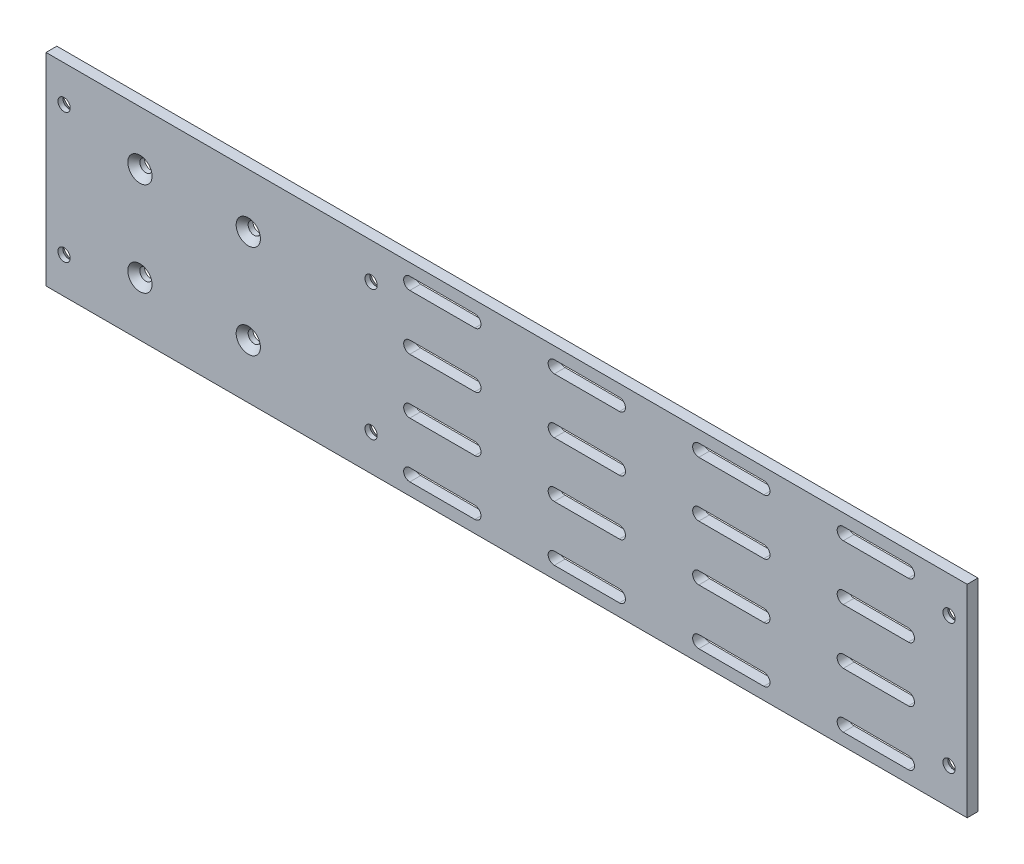
from build123d import *

# Parameters (mm, degrees)
SKETCH_1_W                 = 255
SKETCH_1_H                 = 56
EXTRUDE_1_DEPTH            = 3
HOLE_WIZARD_M32_AT_2_COUNT = 2
HOLE_WIZARD_M32_AT_2_PITCH = 26
HOLE_WIZARD_M32_AT_3_COUNT = 2
HOLE_WIZARD_M32_AT_3_PITCH = 39.698866483
HOLE_WIZARD_M32_AT_4_COUNT = 2
HOLE_WIZARD_M32_AT_4_PITCH = 30
HOLE_WIZARD_M31_AT_2_COUNT = 2
HOLE_WIZARD_M31_AT_2_PITCH = 36
HOLE_WIZARD_M31_AT_3_COUNT = 2
HOLE_WIZARD_M31_AT_3_PITCH = 245
HOLE_WIZARD_M31_AT_4_COUNT = 2
HOLE_WIZARD_M31_AT_4_PITCH = 247.630773532
HOLE_WIZARD_M31_AT_5_COUNT = 2
HOLE_WIZARD_M31_AT_5_PITCH = 85
HOLE_WIZARD_M31_AT_6_COUNT = 2
HOLE_WIZARD_M31_AT_6_PITCH = 92.309262807
CUT_EXTRUDE_3_DEPTH        = 131.572776642


with BuildPart() as part:
    # Эскиз1 → Бобышка-Вытянуть1 (new body)
    with BuildSketch(Plane.XY):
        Rectangle(SKETCH_1_W, SKETCH_1_H)
    extrude(amount=EXTRUDE_1_DEPTH)

    # Эскиз8 → Зенковка для  винта с потайной головкой с внутренним шестигранником M32 (revolve, cut)
    with BuildSketch(Plane(origin=(-101.5, 13, 3), x_dir=(0, -1, 0), z_dir=(1, 0, 0))):
        Polygon((0, 0), (0, 3), (1.7, 3), (1.7, 1.66), (3.36, 0), align=None)
    hole_wizard_m32 = revolve(axis=Axis((-101.5, 13, 9.35), (0, 0, -1)), mode=Mode.SUBTRACT)

    # Зенковка для  винта с потайной головкой с внутренним шестигранником M32 at 2: Зенковка для  винта с потайной головкой с внутренним шестигранником M32 ×2
    with Locations(*[(0, -i * HOLE_WIZARD_M32_AT_2_PITCH, 0) for i in range(1, HOLE_WIZARD_M32_AT_2_COUNT)]):
        add(hole_wizard_m32, mode=Mode.SUBTRACT)

    # Зенковка для  винта с потайной головкой с внутренним шестигранником M32 at 3: Зенковка для  винта с потайной головкой с внутренним шестигранником M32 ×2
    with Locations(*[Vector(0.7556890827898175, -0.6549305384178421, 0) * (i * HOLE_WIZARD_M32_AT_3_PITCH) for i in range(1, HOLE_WIZARD_M32_AT_3_COUNT)]):
        add(hole_wizard_m32, mode=Mode.SUBTRACT)

    # Зенковка для  винта с потайной головкой с внутренним шестигранником M32 at 4: Зенковка для  винта с потайной головкой с внутренним шестигранником M32 ×2
    with Locations(*[(i * HOLE_WIZARD_M32_AT_4_PITCH, 0, 0) for i in range(1, HOLE_WIZARD_M32_AT_4_COUNT)]):
        add(hole_wizard_m32, mode=Mode.SUBTRACT)

    # Эскиз5 → Зенковка для  винта с потайной головкой с внутренним шестигранником M31 (revolve, cut)
    with BuildSketch(Plane(origin=(-122.5, 18, 0), x_dir=(0, 1, 0), z_dir=(1, 0, 0))):
        Polygon((0, 0), (0, 3), (1.7, 3), (1.7, 1.66), (3.36, 0), align=None)
    hole_wizard_m31 = revolve(axis=Axis((-122.5, 18, -6.35), (0, 0, 1)), mode=Mode.SUBTRACT)

    # Зенковка для  винта с потайной головкой с внутренним шестигранником M31 at 2: Зенковка для  винта с потайной головкой с внутренним шестигранником M31 ×2
    with Locations(*[(0, -i * HOLE_WIZARD_M31_AT_2_PITCH, 0) for i in range(1, HOLE_WIZARD_M31_AT_2_COUNT)]):
        add(hole_wizard_m31, mode=Mode.SUBTRACT)

    # Зенковка для  винта с потайной головкой с внутренним шестигранником M31 at 3: Зенковка для  винта с потайной головкой с внутренним шестигранником M31 ×2
    with Locations(*[(i * HOLE_WIZARD_M31_AT_3_PITCH, 0, 0) for i in range(1, HOLE_WIZARD_M31_AT_3_COUNT)]):
        add(hole_wizard_m31, mode=Mode.SUBTRACT)

    # Зенковка для  винта с потайной головкой с внутренним шестигранником M31 at 4: Зенковка для  винта с потайной головкой с внутренним шестигранником M31 ×2
    with Locations(*[Vector(0.989376225360186, -0.1453777310733335, 0) * (i * HOLE_WIZARD_M31_AT_4_PITCH) for i in range(1, HOLE_WIZARD_M31_AT_4_COUNT)]):
        add(hole_wizard_m31, mode=Mode.SUBTRACT)

    # Зенковка для  винта с потайной головкой с внутренним шестигранником M31 at 5: Зенковка для  винта с потайной головкой с внутренним шестигранником M31 ×2
    with Locations(*[(i * HOLE_WIZARD_M31_AT_5_PITCH, 0, 0) for i in range(1, HOLE_WIZARD_M31_AT_5_COUNT)]):
        add(hole_wizard_m31, mode=Mode.SUBTRACT)

    # Зенковка для  винта с потайной головкой с внутренним шестигранником M31 at 6: Зенковка для  винта с потайной головкой с внутренним шестигранником M31 ×2
    with Locations(*[Vector(0.9208176667771373, -0.3899933647526701, 0) * (i * HOLE_WIZARD_M31_AT_6_PITCH) for i in range(1, HOLE_WIZARD_M31_AT_6_COUNT)]):
        add(hole_wizard_m31, mode=Mode.SUBTRACT)

    # Эскиз7 → Вырез-Вытянуть3 (cut, through all)
    with BuildSketch(Plane.XY.offset(3)):
        with BuildLine():
            Line((-26.788260154, 24.7), (-8.788260154, 24.7))
            ThreePointArc((-8.788260154, 24.7), (-7.088260154, 23), (-8.788260154, 21.3))
            Line((-8.788260154, 21.3), (-26.788260154, 21.3))
            ThreePointArc((-26.788260154, 21.3), (-28.488260154, 23), (-26.788260154, 24.7))
        make_face()
        with BuildLine():
            Line((13.211739846, 24.7), (31.211739846, 24.7))
            ThreePointArc((31.211739846, 24.7), (32.911739846, 23), (31.211739846, 21.3))
            Line((31.211739846, 21.3), (13.211739846, 21.3))
            ThreePointArc((13.211739846, 21.3), (11.511739846, 23), (13.211739846, 24.7))
        make_face()
        with BuildLine():
            Line((53.211739846, 24.7), (71.211739846, 24.7))
            ThreePointArc((71.211739846, 24.7), (72.911739846, 23), (71.211739846, 21.3))
            Line((71.211739846, 21.3), (53.211739846, 21.3))
            ThreePointArc((53.211739846, 21.3), (51.511739846, 23), (53.211739846, 24.7))
        make_face()
        with BuildLine():
            Line((93.211739846, 24.7), (111.211739846, 24.7))
            ThreePointArc((111.211739846, 24.7), (112.911739846, 23), (111.211739846, 21.3))
            Line((111.211739846, 21.3), (93.211739846, 21.3))
            ThreePointArc((93.211739846, 21.3), (91.511739846, 23), (93.211739846, 24.7))
        make_face()
        with BuildLine():
            Line((13.211739846, 9.4), (31.211739846, 9.4))
            ThreePointArc((31.211739846, 9.4), (32.911739846, 7.7), (31.211739846, 6))
            Line((31.211739846, 6), (13.211739846, 6))
            ThreePointArc((13.211739846, 6), (11.511739846, 7.7), (13.211739846, 9.4))
        make_face()
        with BuildLine():
            Line((53.211739846, 9.4), (71.211739846, 9.4))
            ThreePointArc((71.211739846, 9.4), (72.911739846, 7.7), (71.211739846, 6))
            Line((71.211739846, 6), (53.211739846, 6))
            ThreePointArc((53.211739846, 6), (51.511739846, 7.7), (53.211739846, 9.4))
        make_face()
        with BuildLine():
            Line((93.211739846, 9.4), (111.211739846, 9.4))
            ThreePointArc((111.211739846, 9.4), (112.911739846, 7.7), (111.211739846, 6))
            Line((111.211739846, 6), (93.211739846, 6))
            ThreePointArc((93.211739846, 6), (91.511739846, 7.7), (93.211739846, 9.4))
        make_face()
        with BuildLine():
            Line((13.211739846, -5.9), (31.211739846, -5.9))
            ThreePointArc((31.211739846, -5.9), (32.911739846, -7.6), (31.211739846, -9.3))
            Line((31.211739846, -9.3), (13.211739846, -9.3))
            ThreePointArc((13.211739846, -9.3), (11.511739846, -7.6), (13.211739846, -5.9))
        make_face()
        with BuildLine():
            Line((53.211739846, -5.9), (71.211739846, -5.9))
            ThreePointArc((71.211739846, -5.9), (72.911739846, -7.6), (71.211739846, -9.3))
            Line((71.211739846, -9.3), (53.211739846, -9.3))
            ThreePointArc((53.211739846, -9.3), (51.511739846, -7.6), (53.211739846, -5.9))
        make_face()
        with BuildLine():
            Line((93.211739846, -5.9), (111.211739846, -5.9))
            ThreePointArc((111.211739846, -5.9), (112.911739846, -7.6), (111.211739846, -9.3))
            Line((111.211739846, -9.3), (93.211739846, -9.3))
            ThreePointArc((93.211739846, -9.3), (91.511739846, -7.6), (93.211739846, -5.9))
        make_face()
        with BuildLine():
            Line((13.211739846, -21.2), (31.211739846, -21.2))
            ThreePointArc((31.211739846, -21.2), (32.911739846, -22.9), (31.211739846, -24.6))
            Line((31.211739846, -24.6), (13.211739846, -24.6))
            ThreePointArc((13.211739846, -24.6), (11.511739846, -22.9), (13.211739846, -21.2))
        make_face()
        with BuildLine():
            Line((53.211739846, -21.2), (71.211739846, -21.2))
            ThreePointArc((71.211739846, -21.2), (72.911739846, -22.9), (71.211739846, -24.6))
            Line((71.211739846, -24.6), (53.211739846, -24.6))
            ThreePointArc((53.211739846, -24.6), (51.511739846, -22.9), (53.211739846, -21.2))
        make_face()
        with BuildLine():
            Line((93.211739846, -21.2), (111.211739846, -21.2))
            ThreePointArc((111.211739846, -21.2), (112.911739846, -22.9), (111.211739846, -24.6))
            Line((111.211739846, -24.6), (93.211739846, -24.6))
            ThreePointArc((93.211739846, -24.6), (91.511739846, -22.9), (93.211739846, -21.2))
        make_face()
        with BuildLine():
            Line((-26.788260154, 9.4), (-8.788260154, 9.4))
            ThreePointArc((-8.788260154, 9.4), (-7.088260154, 7.7), (-8.788260154, 6))
            Line((-8.788260154, 6), (-26.788260154, 6))
            ThreePointArc((-26.788260154, 6), (-28.488260154, 7.7), (-26.788260154, 9.4))
        make_face()
        with BuildLine():
            Line((-26.788260154, -5.9), (-8.788260154, -5.9))
            ThreePointArc((-8.788260154, -5.9), (-7.088260154, -7.6), (-8.788260154, -9.3))
            Line((-8.788260154, -9.3), (-26.788260154, -9.3))
            ThreePointArc((-26.788260154, -9.3), (-28.488260154, -7.6), (-26.788260154, -5.9))
        make_face()
        with BuildLine():
            Line((-26.788260154, -21.2), (-8.788260154, -21.2))
            ThreePointArc((-8.788260154, -21.2), (-7.088260154, -22.9), (-8.788260154, -24.6))
            Line((-8.788260154, -24.6), (-26.788260154, -24.6))
            ThreePointArc((-26.788260154, -24.6), (-28.488260154, -22.9), (-26.788260154, -21.2))
        make_face()
    extrude(amount=-CUT_EXTRUDE_3_DEPTH, mode=Mode.SUBTRACT)


solid = part.part
